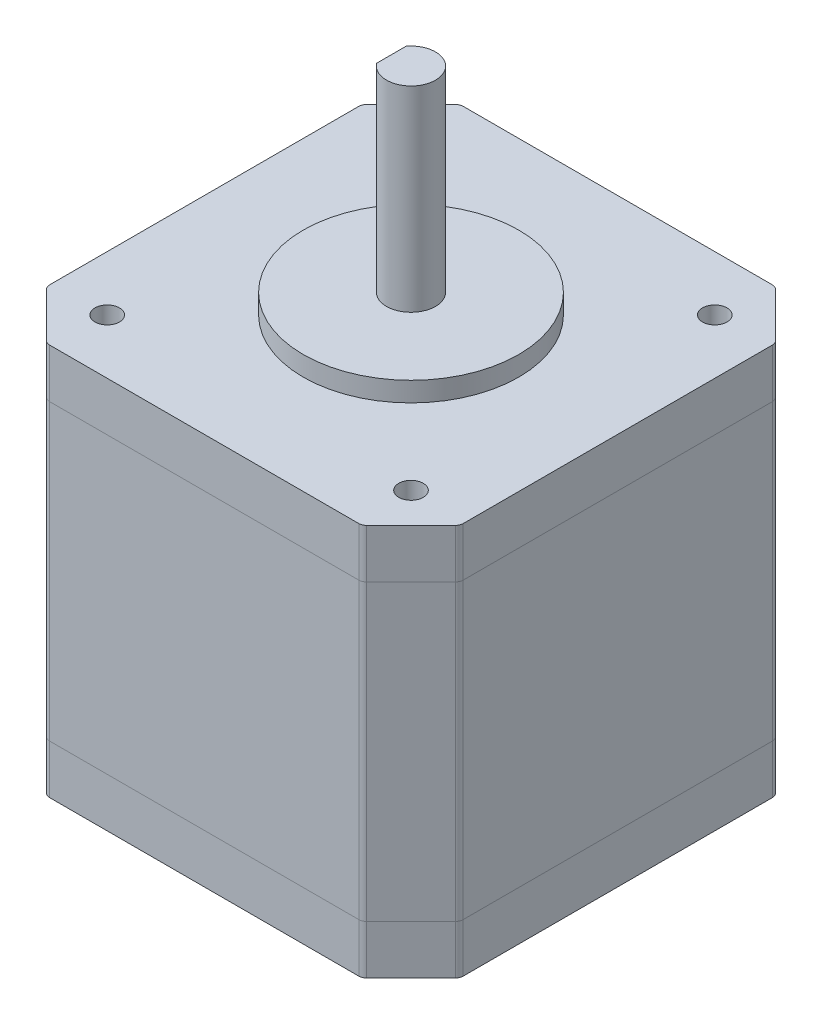
from build123d import *

# Parameters (mm, degrees)
SKETCH_1_R          = 1.25
SKETCH_1_R_2        = 11
EXTRUDE_1_DEPTH     = 40
SKETCH_1_6_R        = 1.25
SKETCH_1_6_R_2      = 11
CUT_EXTRUDE_1_DEPTH = 35
SKETCH_1_7_R        = 1.25
SKETCH_1_7_R_2      = 11
EXTRUDE_6_DEPTH     = 35
SKETCH_1_8_R        = 1.25
SKETCH_1_8_R_2      = 11
CUT_EXTRUDE_2_DEPTH = 5
SKETCH_1_9_R        = 1.25
SKETCH_1_9_R_2      = 11
EXTRUDE_7_DEPTH     = 5
SKETCH_1_3_R        = 11
EXTRUDE_2_DEPTH     = 42
EXTRUDE_3_DEPTH     = 62
EXTRUDE_4_DEPTH     = 47
SKETCH_2_W          = 14
SKETCH_2_H          = 6
EXTRUDE_5_DEPTH     = 6
FILLET_1_R          = 1


with BuildPart() as part:
    # 草图1 → 凸台-拉伸1 (new body)
    with BuildSketch(Plane(origin=(0, 0, 0), x_dir=(1, 0, 0), z_dir=(0, 1, 0))):
        with BuildLine():
            ThreePointArc((-16.334314575, -20.865685425), (-16.074775896, -21.039103626), (-15.76862915, -21.1))
            Line((-15.76862915, -21.1), (15.76862915, -21.1))
            ThreePointArc((15.76862915, -21.1), (16.074775896, -21.039103626), (16.334314575, -20.865685425))
            Line((16.334314575, -20.865685425), (20.865685425, -16.334314575))
            ThreePointArc((20.865685425, -16.334314575), (21.039103626, -16.074775896), (21.1, -15.76862915))
            Line((21.1, -15.76862915), (21.1, 15.76862915))
            ThreePointArc((21.1, 15.76862915), (21.039103626, 16.074775896), (20.865685425, 16.334314575))
            Line((20.865685425, 16.334314575), (16.334314575, 20.865685425))
            ThreePointArc((16.334314575, 20.865685425), (16.074775896, 21.039103626), (15.76862915, 21.1))
            Line((15.76862915, 21.1), (-15.76862915, 21.1))
            ThreePointArc((-15.76862915, 21.1), (-16.074775896, 21.039103626), (-16.334314575, 20.865685425))
            Line((-16.334314575, 20.865685425), (-20.865685425, 16.334314575))
            ThreePointArc((-20.865685425, 16.334314575), (-21.039103626, 16.074775896), (-21.1, 15.76862915))
            Line((-21.1, 15.76862915), (-21.1, -15.76862915))
            ThreePointArc((-21.1, -15.76862915), (-21.039103626, -16.074775896), (-20.865685425, -16.334314575))
            Line((-20.865685425, -16.334314575), (-16.334314575, -20.865685425))
        make_face()
        with Locations((-15.5, -15.5)):
            Circle(SKETCH_1_R, mode=Mode.SUBTRACT)
        with Locations((15.5, -15.5)):
            Circle(SKETCH_1_R, mode=Mode.SUBTRACT)
        with Locations((-15.5, 15.5)):
            Circle(SKETCH_1_R, mode=Mode.SUBTRACT)
        Circle(SKETCH_1_R_2, mode=Mode.SUBTRACT)
        with Locations((15.5, 15.5)):
            Circle(SKETCH_1_R, mode=Mode.SUBTRACT)
    extrude(amount=EXTRUDE_1_DEPTH)

    # 草图1<6> → 切除-拉伸1 (cut)
    with BuildSketch(Plane(origin=(0, 0, 0), x_dir=(1, 0, 0), z_dir=(0, 1, 0))):
        with BuildLine():
            ThreePointArc((-16.334314575, -20.865685425), (-16.074775896, -21.039103626), (-15.76862915, -21.1))
            Line((-15.76862915, -21.1), (15.76862915, -21.1))
            ThreePointArc((15.76862915, -21.1), (16.074775896, -21.039103626), (16.334314575, -20.865685425))
            Line((16.334314575, -20.865685425), (20.865685425, -16.334314575))
            ThreePointArc((20.865685425, -16.334314575), (21.039103626, -16.074775896), (21.1, -15.76862915))
            Line((21.1, -15.76862915), (21.1, 15.76862915))
            ThreePointArc((21.1, 15.76862915), (21.039103626, 16.074775896), (20.865685425, 16.334314575))
            Line((20.865685425, 16.334314575), (16.334314575, 20.865685425))
            ThreePointArc((16.334314575, 20.865685425), (16.074775896, 21.039103626), (15.76862915, 21.1))
            Line((15.76862915, 21.1), (-15.76862915, 21.1))
            ThreePointArc((-15.76862915, 21.1), (-16.074775896, 21.039103626), (-16.334314575, 20.865685425))
            Line((-16.334314575, 20.865685425), (-20.865685425, 16.334314575))
            ThreePointArc((-20.865685425, 16.334314575), (-21.039103626, 16.074775896), (-21.1, 15.76862915))
            Line((-21.1, 15.76862915), (-21.1, -15.76862915))
            ThreePointArc((-21.1, -15.76862915), (-21.039103626, -16.074775896), (-20.865685425, -16.334314575))
            Line((-20.865685425, -16.334314575), (-16.334314575, -20.865685425))
        make_face()
        with Locations((-15.5, -15.5)):
            Circle(SKETCH_1_6_R, mode=Mode.SUBTRACT)
        with Locations((15.5, -15.5)):
            Circle(SKETCH_1_6_R, mode=Mode.SUBTRACT)
        with Locations((-15.5, 15.5)):
            Circle(SKETCH_1_6_R, mode=Mode.SUBTRACT)
        Circle(SKETCH_1_6_R_2, mode=Mode.SUBTRACT)
        with Locations((15.5, 15.5)):
            Circle(SKETCH_1_6_R, mode=Mode.SUBTRACT)
    extrude(amount=CUT_EXTRUDE_1_DEPTH, mode=Mode.SUBTRACT)

    # 草图1<3> → 凸台-拉伸2 (add)
    with BuildSketch(Plane(origin=(0, 0, 0), x_dir=(1, 0, 0), z_dir=(0, 1, 0))):
        Circle(SKETCH_1_3_R)
        with BuildLine():
            ThreePointArc((-2, -1.5), (-2.5, 0), (-2, 1.5))
            ThreePointArc((-2, 1.5), (0.790569415, 2.371708245), (2.5, 0))
            ThreePointArc((2.5, 0), (0.790569415, -2.371708245), (-2, -1.5))
        make_face(mode=Mode.SUBTRACT)
    extrude(amount=EXTRUDE_2_DEPTH)

    # 草图1<4> → 凸台-拉伸3 (add)
    with BuildSketch(Plane(origin=(0, 0, 0), x_dir=(1, 0, 0), z_dir=(0, 1, 0))):
        with BuildLine():
            ThreePointArc((2.5, 0), (0.790569415, 2.371708245), (-2, 1.5))
            Line((-2, 1.5), (-2, -1.5))
            ThreePointArc((-2, -1.5), (0.790569415, -2.371708245), (2.5, 0))
        make_face()
    extrude(amount=EXTRUDE_3_DEPTH)

    # 草图1<5> → 凸台-拉伸4 (add)
    with BuildSketch(Plane(origin=(0, 0, 0), x_dir=(1, 0, 0), z_dir=(0, 1, 0))):
        with BuildLine():
            Line((-2, -1.5), (-2, 1.5))
            ThreePointArc((-2, 1.5), (-2.5, 0), (-2, -1.5))
        make_face()
    extrude(amount=EXTRUDE_4_DEPTH)


with BuildPart() as body_2:
    # 草图1<7> → 凸台-拉伸6 (new body)
    with BuildSketch(Plane(origin=(0, 0, 0), x_dir=(1, 0, 0), z_dir=(0, 1, 0))):
        with BuildLine():
            ThreePointArc((-16.334314575, -20.865685425), (-16.074775896, -21.039103626), (-15.76862915, -21.1))
            Line((-15.76862915, -21.1), (15.76862915, -21.1))
            ThreePointArc((15.76862915, -21.1), (16.074775896, -21.039103626), (16.334314575, -20.865685425))
            Line((16.334314575, -20.865685425), (20.865685425, -16.334314575))
            ThreePointArc((20.865685425, -16.334314575), (21.039103626, -16.074775896), (21.1, -15.76862915))
            Line((21.1, -15.76862915), (21.1, 15.76862915))
            ThreePointArc((21.1, 15.76862915), (21.039103626, 16.074775896), (20.865685425, 16.334314575))
            Line((20.865685425, 16.334314575), (16.334314575, 20.865685425))
            ThreePointArc((16.334314575, 20.865685425), (16.074775896, 21.039103626), (15.76862915, 21.1))
            Line((15.76862915, 21.1), (-15.76862915, 21.1))
            ThreePointArc((-15.76862915, 21.1), (-16.074775896, 21.039103626), (-16.334314575, 20.865685425))
            Line((-16.334314575, 20.865685425), (-20.865685425, 16.334314575))
            ThreePointArc((-20.865685425, 16.334314575), (-21.039103626, 16.074775896), (-21.1, 15.76862915))
            Line((-21.1, 15.76862915), (-21.1, -15.76862915))
            ThreePointArc((-21.1, -15.76862915), (-21.039103626, -16.074775896), (-20.865685425, -16.334314575))
            Line((-20.865685425, -16.334314575), (-16.334314575, -20.865685425))
        make_face()
        with Locations((-15.5, -15.5)):
            Circle(SKETCH_1_7_R, mode=Mode.SUBTRACT)
        with Locations((15.5, -15.5)):
            Circle(SKETCH_1_7_R, mode=Mode.SUBTRACT)
        with Locations((-15.5, 15.5)):
            Circle(SKETCH_1_7_R, mode=Mode.SUBTRACT)
        Circle(SKETCH_1_7_R_2, mode=Mode.SUBTRACT)
        with Locations((15.5, 15.5)):
            Circle(SKETCH_1_7_R, mode=Mode.SUBTRACT)
    extrude(amount=EXTRUDE_6_DEPTH)

    # 草图1<8> → 切除-拉伸2 (cut)
    with BuildSketch(Plane(origin=(0, 0, 0), x_dir=(1, 0, 0), z_dir=(0, 1, 0))):
        with BuildLine():
            ThreePointArc((-16.334314575, -20.865685425), (-16.074775896, -21.039103626), (-15.76862915, -21.1))
            Line((-15.76862915, -21.1), (15.76862915, -21.1))
            ThreePointArc((15.76862915, -21.1), (16.074775896, -21.039103626), (16.334314575, -20.865685425))
            Line((16.334314575, -20.865685425), (20.865685425, -16.334314575))
            ThreePointArc((20.865685425, -16.334314575), (21.039103626, -16.074775896), (21.1, -15.76862915))
            Line((21.1, -15.76862915), (21.1, 15.76862915))
            ThreePointArc((21.1, 15.76862915), (21.039103626, 16.074775896), (20.865685425, 16.334314575))
            Line((20.865685425, 16.334314575), (16.334314575, 20.865685425))
            ThreePointArc((16.334314575, 20.865685425), (16.074775896, 21.039103626), (15.76862915, 21.1))
            Line((15.76862915, 21.1), (-15.76862915, 21.1))
            ThreePointArc((-15.76862915, 21.1), (-16.074775896, 21.039103626), (-16.334314575, 20.865685425))
            Line((-16.334314575, 20.865685425), (-20.865685425, 16.334314575))
            ThreePointArc((-20.865685425, 16.334314575), (-21.039103626, 16.074775896), (-21.1, 15.76862915))
            Line((-21.1, 15.76862915), (-21.1, -15.76862915))
            ThreePointArc((-21.1, -15.76862915), (-21.039103626, -16.074775896), (-20.865685425, -16.334314575))
            Line((-20.865685425, -16.334314575), (-16.334314575, -20.865685425))
        make_face()
        with Locations((-15.5, -15.5)):
            Circle(SKETCH_1_8_R, mode=Mode.SUBTRACT)
        with Locations((15.5, -15.5)):
            Circle(SKETCH_1_8_R, mode=Mode.SUBTRACT)
        with Locations((-15.5, 15.5)):
            Circle(SKETCH_1_8_R, mode=Mode.SUBTRACT)
        Circle(SKETCH_1_8_R_2, mode=Mode.SUBTRACT)
        with Locations((15.5, 15.5)):
            Circle(SKETCH_1_8_R, mode=Mode.SUBTRACT)
    extrude(amount=CUT_EXTRUDE_2_DEPTH, mode=Mode.SUBTRACT)


with BuildPart() as body_3:
    # 草图1<9> → 凸台-拉伸7 (new body)
    with BuildSketch(Plane(origin=(0, 0, 0), x_dir=(1, 0, 0), z_dir=(0, 1, 0))):
        with BuildLine():
            ThreePointArc((-16.334314575, -20.865685425), (-16.074775896, -21.039103626), (-15.76862915, -21.1))
            Line((-15.76862915, -21.1), (15.76862915, -21.1))
            ThreePointArc((15.76862915, -21.1), (16.074775896, -21.039103626), (16.334314575, -20.865685425))
            Line((16.334314575, -20.865685425), (20.865685425, -16.334314575))
            ThreePointArc((20.865685425, -16.334314575), (21.039103626, -16.074775896), (21.1, -15.76862915))
            Line((21.1, -15.76862915), (21.1, 15.76862915))
            ThreePointArc((21.1, 15.76862915), (21.039103626, 16.074775896), (20.865685425, 16.334314575))
            Line((20.865685425, 16.334314575), (16.334314575, 20.865685425))
            ThreePointArc((16.334314575, 20.865685425), (16.074775896, 21.039103626), (15.76862915, 21.1))
            Line((15.76862915, 21.1), (-15.76862915, 21.1))
            ThreePointArc((-15.76862915, 21.1), (-16.074775896, 21.039103626), (-16.334314575, 20.865685425))
            Line((-16.334314575, 20.865685425), (-20.865685425, 16.334314575))
            ThreePointArc((-20.865685425, 16.334314575), (-21.039103626, 16.074775896), (-21.1, 15.76862915))
            Line((-21.1, 15.76862915), (-21.1, -15.76862915))
            ThreePointArc((-21.1, -15.76862915), (-21.039103626, -16.074775896), (-20.865685425, -16.334314575))
            Line((-20.865685425, -16.334314575), (-16.334314575, -20.865685425))
        make_face()
        with Locations((-15.5, -15.5)):
            Circle(SKETCH_1_9_R, mode=Mode.SUBTRACT)
        with Locations((15.5, -15.5)):
            Circle(SKETCH_1_9_R, mode=Mode.SUBTRACT)
        with Locations((-15.5, 15.5)):
            Circle(SKETCH_1_9_R, mode=Mode.SUBTRACT)
        Circle(SKETCH_1_9_R_2, mode=Mode.SUBTRACT)
        with Locations((15.5, 15.5)):
            Circle(SKETCH_1_9_R, mode=Mode.SUBTRACT)
    extrude(amount=EXTRUDE_7_DEPTH)


with BuildPart() as body_4:
    # 草图2 → 凸台-拉伸5 (new body)
    with BuildSketch(Plane(origin=(0, 0, -21.1), x_dir=(-1, 0, 0), z_dir=(0, 0, -1))):
        with Locations((0, 3)):
            Rectangle(SKETCH_2_W, SKETCH_2_H)
    extrude(amount=EXTRUDE_5_DEPTH)

    # 圆角1
    fillet_1_edges = [body_4.edges().sort_by_distance(p)[0] for p in [
        (0, 0, -27.1),
        (7, 3, -27.1),
        (0, 6, -27.1),
        (-7, 3, -27.1),
        (-7, 0, -24.1),
        (-7, 6, -24.1),
        (7, 0, -24.1),
        (7, 6, -24.1),
    ]]
    fillet(fillet_1_edges, radius=FILLET_1_R)


solid = Compound([part.part, body_2.part, body_3.part, body_4.part])
